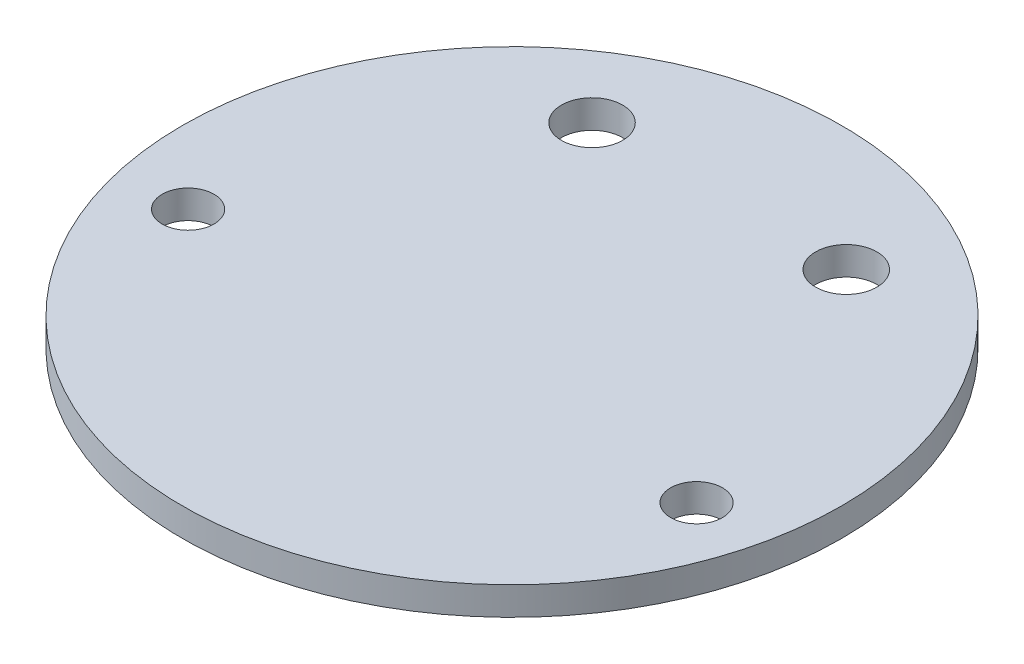
from build123d import *

# Parameters (mm, degrees)
SKETCH2_W          = 35
SKETCH2_H          = 3
CUT_EXTRUDE1_REACH = 51.588
SKETCH3_R          = 3.25
CUT_EXTRUDE2_REACH = 51.588
SKETCH4_R          = 2.75


with BuildPart() as part:
    # Sketch2 → Revolve1 (revolve)
    with BuildSketch(Plane.XY):
        with Locations((17.5, 1.5)):
            Rectangle(SKETCH2_W, SKETCH2_H)
    revolve(axis=Axis((0, -417.112175525, 0), (0, 1, 0)))

    # Sketch3 → Cut-Extrude1 (cut, up to next)
    with BuildSketch(Plane(origin=(0, 3, 0), x_dir=(1, 0, 0), z_dir=(0, 1, 0)), mode=Mode.PRIVATE) as cut_extrude1_sk1:
        with Locations((-13.5, 22)):
            Circle(SKETCH3_R)
    cut_extrude1_tool1 = extrude(cut_extrude1_sk1.sketch, amount=-CUT_EXTRUDE1_REACH, mode=Mode.PRIVATE) & part.part
    # Sketch3 → Cut-Extrude1 (cut, up to next)
    with BuildSketch(Plane(origin=(0, 3, 0), x_dir=(1, 0, 0), z_dir=(0, 1, 0)), mode=Mode.PRIVATE) as cut_extrude1_sk2:
        with Locations((13.5, 22)):
            Circle(SKETCH3_R)
    cut_extrude1_tool2 = extrude(cut_extrude1_sk2.sketch, amount=-CUT_EXTRUDE1_REACH, mode=Mode.PRIVATE) & part.part
    add(cut_extrude1_tool1.solids().sort_by_distance((-13.5, 3, -22))[0], mode=Mode.SUBTRACT)
    add(cut_extrude1_tool2.solids().sort_by_distance((13.5, 3, -22))[0], mode=Mode.SUBTRACT)

    # Sketch4 → Cut-Extrude2 (cut, up to next)
    with BuildSketch(Plane(origin=(0, 3, 0), x_dir=(1, 0, 0), z_dir=(0, 1, 0)), mode=Mode.PRIVATE) as cut_extrude2_sk1:
        with Locations((-27, -7.4)):
            Circle(SKETCH4_R)
    cut_extrude2_tool1 = extrude(cut_extrude2_sk1.sketch, amount=-CUT_EXTRUDE2_REACH, mode=Mode.PRIVATE) & part.part
    # Sketch4 → Cut-Extrude2 (cut, up to next)
    with BuildSketch(Plane(origin=(0, 3, 0), x_dir=(1, 0, 0), z_dir=(0, 1, 0)), mode=Mode.PRIVATE) as cut_extrude2_sk2:
        with Locations((27, -7.4)):
            Circle(SKETCH4_R)
    cut_extrude2_tool2 = extrude(cut_extrude2_sk2.sketch, amount=-CUT_EXTRUDE2_REACH, mode=Mode.PRIVATE) & part.part
    add(cut_extrude2_tool1.solids().sort_by_distance((-27, 3, 7.4))[0], mode=Mode.SUBTRACT)
    add(cut_extrude2_tool2.solids().sort_by_distance((27, 3, 7.4))[0], mode=Mode.SUBTRACT)


solid = part.part
